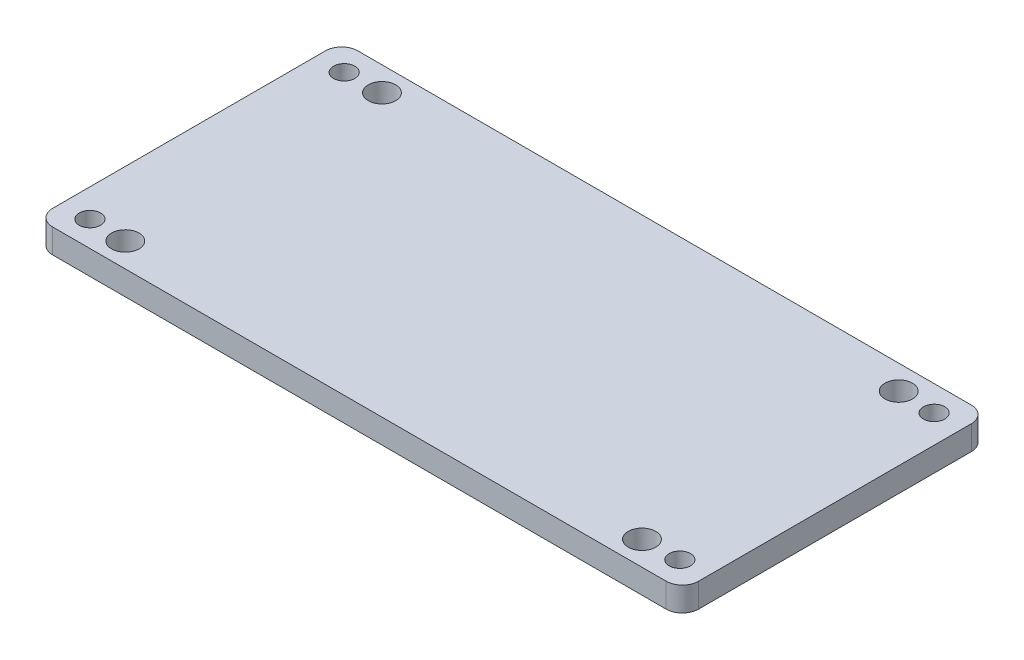
from build123d import *

# Parameters (mm, degrees)
SKETCH1_W               = 127
SKETCH1_H               = 60
BOSS_EXTRUDE1_DEPTH     = 4.7625
M5X0_8_TAPPED_HOLE1_D   = 4.2
F_1_4_28_TAPPED_HOLE1_D = 5.4102
FILLET1_R               = 3.175


with BuildPart() as part:
    # Sketch1 → Boss-Extrude1 (new body)
    with BuildSketch(Plane(origin=(0, 0, 0), x_dir=(1, 0, 0), z_dir=(0, 1, 0))):
        Rectangle(SKETCH1_W, SKETCH1_H)
    extrude(amount=BOSS_EXTRUDE1_DEPTH)

    # M5x0.8 Tapped Hole1 (through all)
    with Locations(Plane(origin=(0, 4.7625, 0), x_dir=(1, 0, 0), z_dir=(0, 1, 0))):
        with Locations((-58, 25), (58, 25), (58, -25), (-58, -25)):
            Hole(M5X0_8_TAPPED_HOLE1_D / 2)

    # 1/4-28 Tapped Hole1 (through all)
    with Locations(Plane(origin=(0, 0, 0), x_dir=(-1, 0, 0), z_dir=(0, -1, 0))):
        with Locations((-50.8, 25.2375), (50.8, 25.2375), (50.8, -25.2375), (-50.8, -25.2375)):
            Hole(F_1_4_28_TAPPED_HOLE1_D / 2)

    # Fillet1
    fillet1_edges = [part.edges().sort_by_distance(p)[0] for p in [
        (63.5, 2.38125, 30),
        (63.5, 2.38125, -30),
        (-63.5, 2.38125, -30),
        (-63.5, 2.38125, 30),
    ]]
    fillet(fillet1_edges, radius=FILLET1_R)


solid = part.part
